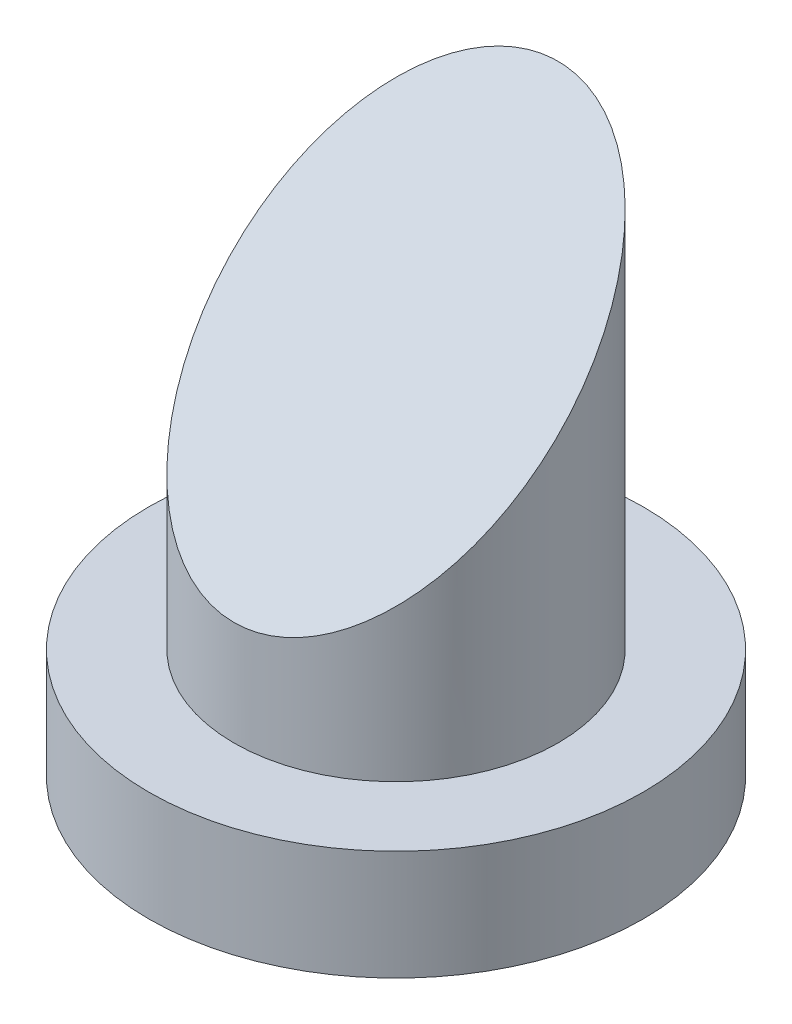
from build123d import *

# Parameters (mm, degrees)
SKETCH1_R               = 9
BOSS_EXTRUDE1_DEPTH     = 4
SKETCH2_R               = 5.9
BOSS_EXTRUDE2_DEPTH     = 20
CUT_EXTRUDE1_DEPTH      = 28.166155414
CUT_EXTRUDE1_DEPTH_BACK = 28.166155414


with BuildPart() as part:
    # Sketch1 → Boss-Extrude1 (new body)
    with BuildSketch(Plane(origin=(0, 0, 0), x_dir=(1, 0, 0), z_dir=(0, 1, 0))):
        Circle(SKETCH1_R)
    extrude(amount=BOSS_EXTRUDE1_DEPTH)

    # Sketch2 → Boss-Extrude2 (add)
    with BuildSketch(Plane(origin=(0, 4, 0), x_dir=(1, 0, 0), z_dir=(0, 1, 0))):
        Circle(SKETCH2_R)
    extrude(amount=BOSS_EXTRUDE2_DEPTH)

    # Sketch3 → Cut-Extrude1 (cut, two sides: drawn at the far end of the back side and taken through both)
    with BuildSketch(Plane(origin=(0, 0, 0), x_dir=(0, 0, -1), z_dir=(1, 0, 0)).offset(-CUT_EXTRUDE1_DEPTH_BACK)):
        Polygon((-6.28, 28.771900514), (-6.28, 7.42), (6.28, 19.98), (6.28, 28.771900514), align=None)
    extrude(amount=CUT_EXTRUDE1_DEPTH + CUT_EXTRUDE1_DEPTH_BACK, mode=Mode.SUBTRACT)


solid = part.part
